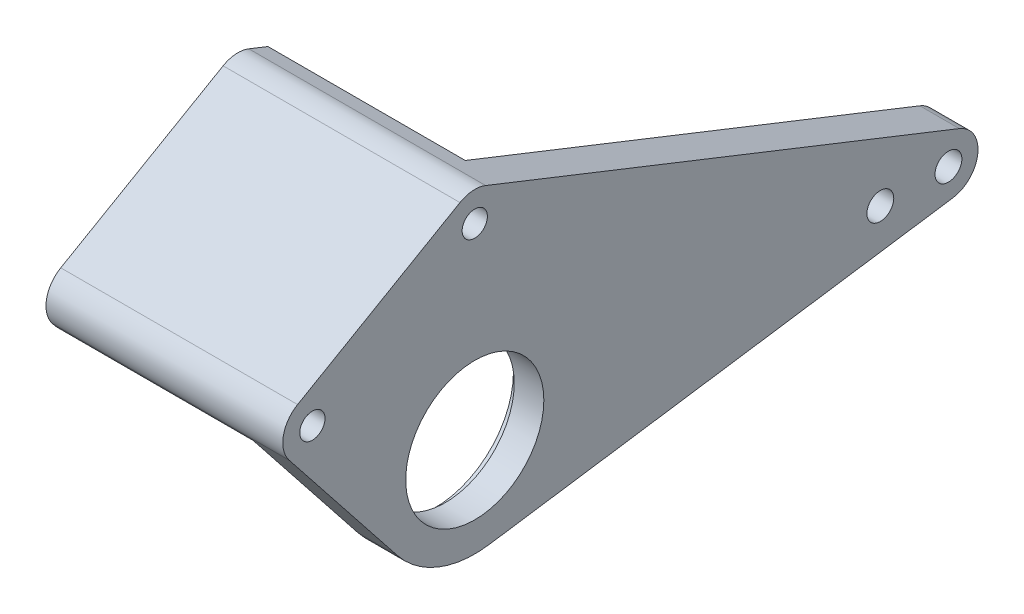
from build123d import *

# Parameters (mm, degrees)
SKETCH1_R           = 2.159
SKETCH1_R_2         = 11.112499999999992
SKETCH1_R_3         = 2.032000000000007
SKETCH1_R_4         = 2.0320000000000227
SKETCH1_R_5         = 2.159000000000001
BOSS_EXTRUDE1_DEPTH = 6.35
SKETCH2_R           = 12.573000000000004
CUT_EXTRUDE1_DEPTH  = 1.5875
BOSS_EXTRUDE2_DEPTH = 31.75
FILLET1_R           = 3.175


with BuildPart() as part:
    # Sketch1 → Boss-Extrude1 (new body)
    with BuildSketch(Plane(origin=(0, 0, 0), x_dir=(0, 0, -1), z_dir=(1, 0, 0))):
        with BuildLine():
            Line((1.7528307479226393, 4.428203994751931), (-74.44716925207737, 34.59070399475192))
            ThreePointArc((-74.44716925207737, 34.59070399475192), (-76.54899129091997, 34.912195919620736), (-78.58125, 34.28694598552338))
            Line((-78.58125, 34.28694598552338), (-104.70274124164806, 19.205695985523498))
            ThreePointArc((-104.70274124164806, 19.205695985523498), (-106.99949191381467, 15.974399461853373), (-106.05477455872966, 12.124224142081344))
            Line((-106.05477455872966, 12.124224142081344), (-88.64427772360533, -9.856752859729227))
            ThreePointArc((-88.64427772360533, -9.856752859729227), (-82.04819337667968, -14.758531743671528), (-73.88489583333335, -15.705283114209777))
            Line((-73.88489583333335, -15.705283114209777), (0.6945312500000005, -4.711584934262932))
            ThreePointArc((0.6945312500000005, -4.711584934262932), (4.730891100411702, -0.5477916082283132), (1.7528307479226393, 4.428203994751931))
        make_face()
        Circle(SKETCH1_R, mode=Mode.SUBTRACT)
        with Locations((-76.2, -9.33e-15)):
            Circle(SKETCH1_R_2, mode=Mode.SUBTRACT)
        with Locations((-76.2, 30.162499999999987)):
            Circle(SKETCH1_R_3, mode=Mode.SUBTRACT)
        with Locations((-102.32149124164806, 15.081250000000113)):
            Circle(SKETCH1_R_4, mode=Mode.SUBTRACT)
        with Locations((-10.95502, -1.34e-15)):
            Circle(SKETCH1_R_5, mode=Mode.SUBTRACT)
    extrude(amount=BOSS_EXTRUDE1_DEPTH)

    # Sketch2 → Cut-Extrude1 (cut)
    with BuildSketch(Plane(origin=(6.35, 0, 0), x_dir=(0, 0, -1), z_dir=(1, 0, 0))):
        with Locations((-76.2, -9.33e-15)):
            Circle(SKETCH2_R)
    extrude(amount=-CUT_EXTRUDE1_DEPTH, mode=Mode.SUBTRACT)

    # Sketch3 → Boss-Extrude2 (add)
    with BuildSketch(Plane(origin=(6.35, 0, 0), x_dir=(0, 0, -1), z_dir=(1, 0, 0))):
        with BuildLine():
            Line((-71.374, 33.37424116580463), (-74.44716925207737, 34.59070399475192))
            ThreePointArc((-74.44716925207737, 34.59070399475192), (-76.54899129091999, 34.912195919620736), (-78.58125000000001, 34.286945985523374))
            Line((-78.58125000000001, 34.286945985523374), (-104.70274124164803, 19.20569598552344))
            ThreePointArc((-104.70274124164803, 19.20569598552344), (-106.9994919138146, 15.974399461853341), (-106.05477455872966, 12.124224142081346))
            Line((-106.05477455872966, 12.124224142081344), (-102.19507254945981, 7.251300531513006))
            ThreePointArc((-102.19507254945981, 7.251300531513006), (-101.25999910991413, 10.016067135413087), (-100.03183060675102, 12.663688490369834))
            Line((-100.03183060675087, 12.663688490369697), (-102.32149124164805, 11.341752306458922))
            Line((-102.32149124164805, 11.341752306458922), (-105.55999124164805, 13.211501153229527))
            Line((-105.55999124164805, 13.211501153229527), (-105.55999124164805, 16.950998846770727))
            Line((-105.55999124164805, 16.950998846770727), (-102.32149124164808, 18.820747693541325))
            Line((-102.32149124164808, 18.820747693541325), (-99.08299124164807, 16.95099884677072))
            Line((-99.08299124164807, 16.95099884677072), (-99.08299124164807, 14.307126478949076))
            ThreePointArc((-99.08299124164829, 14.307126478949137), (-89.6937500000007, 23.371860584632124), (-77.14883936510445, 26.970814969318738))
            Line((-77.14883936510427, 26.97081496931942), (-79.4385, 28.292751153229368))
            Line((-79.4385, 28.292751153229368), (-79.4385, 32.03224884677059))
            Line((-79.4385, 32.03224884677059), (-76.19999999999999, 33.901997693541205))
            Line((-76.19999999999999, 33.901997693541205), (-72.9615, 32.03224884677061))
            Line((-72.9615, 32.03224884677061), (-72.9615, 28.292751153229386))
            Line((-72.9615, 28.292751153229386), (-75.25116063489577, 26.97081496931942))
            ThreePointArc((-75.25116063489558, 26.970814969318738), (-73.30501454969252, 26.8317762269386), (-71.374, 26.552492919686465))
            Line((-71.374, 26.552492919686458), (-71.374, 33.37424116580463))
        make_face()
    extrude(amount=BOSS_EXTRUDE2_DEPTH)

    # Fillet1
    fillet1_edges = [part.edges().sort_by_distance(p)[0] for p in [
        (22.225, 26.55249291968646, 71.374),
        (22.225, 7.251300531513006, 102.19507254945981),
    ]]
    fillet(fillet1_edges, radius=FILLET1_R)


with BuildPart() as body_2:
    # Mirror1: mirrored copy
    add(part.part.mirror(Plane(origin=(6.35, 0, 0), x_dir=(0, 0, 1), z_dir=(1, 0, 0))))


solid = body_2.part
